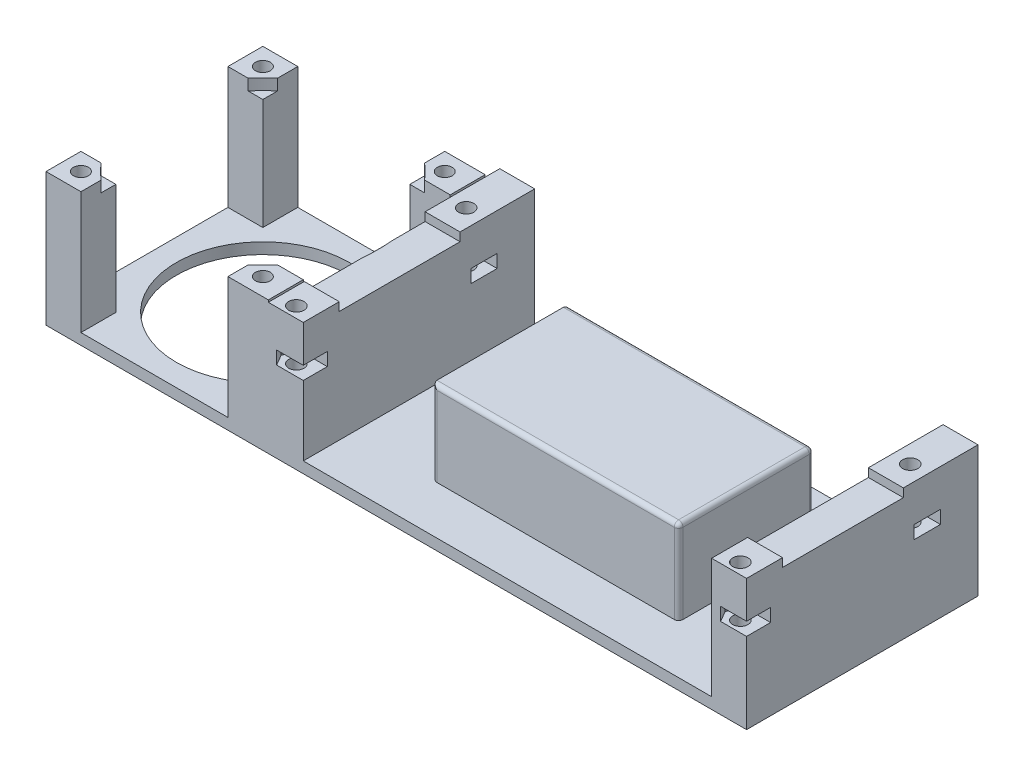
from build123d import *

# Parameters (mm, degrees)
SKETCH1_W           = 109.51405142
SKETCH1_H           = 53
SKETCH1_R           = 1.75
BOSS_EXTRUDE1_DEPTH = 30
SKETCH2_W           = 93.51405142
SKETCH2_H           = 27.46
CUT_EXTRUDE1_DEPTH  = 239.893281613
SKETCH4_W           = 53.34
SKETCH4_H           = 27.94
CUT_EXTRUDE3_DEPTH  = 239.587618287
SKETCH5_W           = 56.34
SKETCH5_H           = 30.94
SKETCH5_W_2         = 53.34
SKETCH5_H_2         = 27.94
BOSS_EXTRUDE2_DEPTH = 17.78
SKETCH6_W           = 56.34
SKETCH6_H           = 30.94
BOSS_EXTRUDE3_DEPTH = 1.5
SKETCH7_W           = 7.62
SKETCH7_H           = 17.78
CUT_EXTRUDE4_DEPTH  = 237.429314807
SKETCH9_W           = 17.94
SKETCH9_H           = 2.25
CUT_EXTRUDE5_DEPTH  = 5
SKETCH10_W          = 8
SKETCH10_H          = 11.94
CUT_EXTRUDE6_DEPTH  = 2.54
SKETCH13_W          = 10
SKETCH13_H          = 37.94
CUT_EXTRUDE8_DEPTH  = 1
FILLET2_R           = 1
SKETCH11_W          = 27.660998728
SKETCH11_H          = 1.943421484
CUT_EXTRUDE7_DEPTH  = 126.308928087
SKETCH14_W          = 50.91
SKETCH14_H          = 49.656
SKETCH14_R          = 19.812
SKETCH14_R_2        = 1.7
BOSS_EXTRUDE4_DEPTH = 2.54
SKETCH15_W          = 8
SKETCH15_H          = 8
SKETCH15_R          = 1.7
SKETCH15_W_2        = 9.25
BOSS_EXTRUDE5_DEPTH = 27.94
SKETCH16_R          = 26.289
CUT_EXTRUDE9_DEPTH  = 2.54
CUT_EXTRUDE2_DEPTH  = 1.5
CUT_EXTRUDE11_DEPTH = 1


with BuildPart() as part:
    # Sketch1 → Boss-Extrude1 (new body)
    with BuildSketch(Plane(origin=(0, 0, 0), x_dir=(1, 0, 0), z_dir=(0, 1, 0))):
        with Locations((-176.24297429, 26.5)):
            Rectangle(SKETCH1_W, SKETCH1_H)
        with Locations(Location((-227.083491572, 41.4, 0), (0, 0, 270))):
            Circle(SKETCH1_R, mode=Mode.SUBTRACT)
        with Locations(Location((-227.083491572, 2.501598642, 0), (0, 0, 270))):
            Circle(SKETCH1_R, mode=Mode.SUBTRACT)
        with Locations(Location((-125.40594858, 41.4, 0), (0, 0, 270))):
            Circle(SKETCH1_R, mode=Mode.SUBTRACT)
        with Locations(Location((-125.40594858, 2.501598642, 0), (0, 0, 270))):
            Circle(SKETCH1_R, mode=Mode.SUBTRACT)
    extrude(amount=BOSS_EXTRUDE1_DEPTH)

    # Sketch2 → Cut-Extrude1 (cut, through all)
    with BuildSketch(Plane.XY):
        with Locations((-176.24297429, 16.27)):
            Rectangle(SKETCH2_W, SKETCH2_H)
    extrude(amount=-CUT_EXTRUDE1_DEPTH, mode=Mode.SUBTRACT)

    # Sketch4 → Cut-Extrude3 (cut, through all)
    with BuildSketch(Plane(origin=(0, 2.54, 0), x_dir=(1, 0, 0), z_dir=(0, 1, 0))):
        with Locations((-176.24297429, 26.5)):
            Rectangle(SKETCH4_W, SKETCH4_H)
    extrude(amount=-CUT_EXTRUDE3_DEPTH, mode=Mode.SUBTRACT)

    # Sketch5 → Boss-Extrude2 (add)
    with BuildSketch(Plane(origin=(0, 2.54, 0), x_dir=(1, 0, 0), z_dir=(0, 1, 0))):
        with Locations((-176.24297429, 26.5)):
            Rectangle(SKETCH5_W, SKETCH5_H)
        with Locations((-176.24297429, 26.5)):
            Rectangle(SKETCH5_W_2, SKETCH5_H_2, mode=Mode.SUBTRACT)
    extrude(amount=BOSS_EXTRUDE2_DEPTH)

    # Sketch6 → Boss-Extrude3 (add)
    with BuildSketch(Plane(origin=(0, 20.32, 0), x_dir=(1, 0, 0), z_dir=(0, 1, 0))):
        with Locations((-176.24297429, 26.5)):
            Rectangle(SKETCH6_W, SKETCH6_H)
    extrude(amount=BOSS_EXTRUDE3_DEPTH)

    # Sketch7 → Cut-Extrude4 (cut, through all)
    with BuildSketch(Plane.XY.offset(-40.47)):
        with Locations((-153.38297429, 11.43)):
            Rectangle(SKETCH7_W, SKETCH7_H)
    extrude(amount=-CUT_EXTRUDE4_DEPTH, mode=Mode.SUBTRACT)

    # Sketch9 → Cut-Extrude5 (cut)
    with BuildSketch(Plane(origin=(-202.91297429, 0, 0), x_dir=(0, 0, -1), z_dir=(1, 0, 0))):
        with Locations((26.5, 1.665)):
            Rectangle(SKETCH9_W, SKETCH9_H)
    extrude(amount=-CUT_EXTRUDE5_DEPTH, mode=Mode.SUBTRACT)

    # Sketch10 → Cut-Extrude6 (cut)
    with BuildSketch(Plane.XZ):
        with Locations((-145.57297429, -26.5)):
            Rectangle(SKETCH10_W, SKETCH10_H)
    extrude(amount=-CUT_EXTRUDE6_DEPTH, mode=Mode.SUBTRACT)

    # Sketch13 → Cut-Extrude8 (cut)
    with BuildSketch(Plane.XZ):
        with Locations((-154.57297429, -26.5)):
            Rectangle(SKETCH13_W, SKETCH13_H)
    extrude(amount=-CUT_EXTRUDE8_DEPTH, mode=Mode.SUBTRACT)

    # Fillet2
    # the kernel refuses this fillet: 1 mm, written as the material it takes off along each edge
    with BuildSketch(Plane(origin=(-149.07297429, 20.82, -40.97), x_dir=(0, 1, 0), z_dir=(1, 0, 0))) as fillet2_piece_1_section:
        Polygon((0, 0), (FILLET2_R * 1.02, 0), (FILLET2_R * 1.02, -FILLET2_R * 1.02), (0, -FILLET2_R * 1.02), align=None)
    fillet2_piece_1 = extrude(amount=FILLET2_R * 1.02, mode=Mode.PRIVATE)
    fillet2_piece_1 = fillet2_piece_1 - Plane(origin=(-149.07297429, 20.82, -40.97), x_dir=(0, -0.7071067811865475, 0.7071067811865475), z_dir=(1, 0, 0)) * Sphere(FILLET2_R, mode=Mode.PRIVATE)
    add(fillet2_piece_1, mode=Mode.SUBTRACT)
    with BuildSketch(Plane(origin=(-149.07297429, 20.82, -12.03), x_dir=(0, 1, 0), z_dir=(1, 0, 0))) as fillet2_piece_2_section:
        Polygon((0, 0), (FILLET2_R * 1.02, 0), (FILLET2_R * 1.02, FILLET2_R * 1.02), (0, FILLET2_R * 1.02), align=None)
    fillet2_piece_2 = extrude(amount=FILLET2_R * 1.02, mode=Mode.PRIVATE)
    fillet2_piece_2 = fillet2_piece_2 - Plane(origin=(-149.07297429, 20.82, -12.03), x_dir=(0, -0.7071067811865475, -0.7071067811865475), z_dir=(1, 0, 0)) * Sphere(FILLET2_R, mode=Mode.PRIVATE)
    add(fillet2_piece_2, mode=Mode.SUBTRACT)
    with BuildSketch(Plane(origin=(-157.19297429, 20.32, -40.47), x_dir=(0, 0, -1), z_dir=(0, -1, 0))) as fillet2_piece_3:
        with BuildLine():
            CenterArc((FILLET2_R, -FILLET2_R), FILLET2_R, 90, 90)
            Line((0, -FILLET2_R), (0, 0))
            Line((0, 0), (FILLET2_R, 0))
        make_face()
    extrude(amount=17.78, mode=Mode.SUBTRACT)
    with BuildSketch(Plane(origin=(-148.07297429, 2.54, -20.53), x_dir=(-1, 0, 0), z_dir=(0, 0, -1)), Plane(origin=(-149.57297429, 2.54, -20.53), x_dir=(0, 1, 0), z_dir=(0, 0, -1))) as fillet2_piece_4:
        with BuildLine():
            CenterArc((FILLET2_R, FILLET2_R), FILLET2_R, 180, 90)
            Line((0, FILLET2_R), (0, 0))
            Line((0, 0), (FILLET2_R, 0))
        make_face()
    extrude(amount=11.94, mode=Mode.SUBTRACT)
    with BuildSketch(Plane(origin=(-207.91297429, 2.54, -17.53), x_dir=(-1, 0, 0), z_dir=(0, 0, -1))) as fillet2_piece_5:
        with BuildLine():
            CenterArc((FILLET2_R, -FILLET2_R), FILLET2_R, 90, 90)
            Line((0, -FILLET2_R), (0, 0))
            Line((0, 0), (FILLET2_R, 0))
        make_face()
    extrude(amount=17.94, mode=Mode.SUBTRACT)
    with BuildSketch(Plane(origin=(-204.41297429, 2.79, -35.47), x_dir=(1, 0, 0), z_dir=(0, 0, 1))) as fillet2_piece_6:
        with BuildLine():
            CenterArc((FILLET2_R, FILLET2_R), FILLET2_R, 180, 90)
            Line((0, FILLET2_R), (0, 0))
            Line((0, 0), (FILLET2_R, 0))
        make_face()
    extrude(amount=17.94, mode=Mode.SUBTRACT)
    with BuildSketch(Plane(origin=(-157.19297429, 20.32, -41.97), x_dir=(0, 0, 1), z_dir=(0, -1, 0))) as fillet2_piece_7:
        with BuildLine():
            CenterArc((FILLET2_R, FILLET2_R), FILLET2_R, 180, 90)
            Line((0, FILLET2_R), (0, 0))
            Line((0, 0), (FILLET2_R, 0))
        make_face()
    extrude(amount=17.78, mode=Mode.SUBTRACT)
    with BuildSketch(Plane(origin=(-206.91297429, 21.82, -41.97), x_dir=(0, 0, 1), z_dir=(1, 0, 0)), Plane(origin=(-149.07297429, 21.82, -11.03), x_dir=(0, 0, -1), z_dir=(-1, 0, 0))) as fillet2_piece_8:
        with BuildLine():
            CenterArc((FILLET2_R, FILLET2_R), FILLET2_R, 180, 90)
            Line((0, FILLET2_R), (0, 0))
            Line((0, 0), (FILLET2_R, 0))
        make_face()
    extrude(amount=57.84, mode=Mode.SUBTRACT)
    with BuildSketch(Plane(origin=(-204.41297429, 2.54, -41.97), x_dir=(0, 0, 1), z_dir=(0, 1, 0))) as fillet2_piece_9:
        with BuildLine():
            CenterArc((FILLET2_R, FILLET2_R), FILLET2_R, 180, 90)
            Line((0, FILLET2_R), (0, 0))
            Line((0, 0), (FILLET2_R, 0))
        make_face()
    extrude(amount=21.78, mode=Mode.SUBTRACT)
    with BuildSketch(Plane(origin=(-148.07297429, 2.54, -41.97), x_dir=(0, 0, 1), z_dir=(0, 1, 0))) as fillet2_piece_10:
        with BuildLine():
            CenterArc((FILLET2_R, -FILLET2_R), FILLET2_R, 90, 90)
            Line((0, -FILLET2_R), (0, 0))
            Line((0, 0), (FILLET2_R, 0))
        make_face()
    extrude(amount=18.28, mode=Mode.SUBTRACT)
    with BuildSketch(Plane(origin=(-148.07297429, 21.82, -40.97), x_dir=(0, -1, 0), z_dir=(0, 0, 1))) as fillet2_piece_11:
        with BuildLine():
            CenterArc((FILLET2_R, -FILLET2_R), FILLET2_R, 90, 90)
            Line((0, -FILLET2_R), (0, 0))
            Line((0, 0), (FILLET2_R, 0))
        make_face()
    extrude(amount=28.94, mode=Mode.SUBTRACT)
    with BuildSketch(Plane(origin=(-148.07297429, 2.54, -11.03), x_dir=(0, 0, -1), z_dir=(0, 1, 0))) as fillet2_piece_12:
        with BuildLine():
            CenterArc((FILLET2_R, FILLET2_R), FILLET2_R, 180, 90)
            Line((0, FILLET2_R), (0, 0))
            Line((0, 0), (FILLET2_R, 0))
        make_face()
    extrude(amount=18.28, mode=Mode.SUBTRACT)
    with BuildSketch(Plane(origin=(-204.41297429, 24.32, -11.03), x_dir=(1, 0, 0), z_dir=(0, -1, 0))) as fillet2_piece_13:
        with BuildLine():
            CenterArc((FILLET2_R, -FILLET2_R), FILLET2_R, 90, 90)
            Line((0, -FILLET2_R), (0, 0))
            Line((0, 0), (FILLET2_R, 0))
        make_face()
    extrude(amount=21.78, mode=Mode.SUBTRACT)

    # Sketch11 → Cut-Extrude7 (cut, through all)
    with BuildSketch(Plane.ZY.offset(231)):
        with Locations((-22.072453187, 29.028289258)):
            Rectangle(SKETCH11_W, SKETCH11_H)
    extrude(amount=-CUT_EXTRUDE7_DEPTH, mode=Mode.SUBTRACT)

    # Sketch14 → Boss-Extrude4 (add)
    with BuildSketch(Plane.XZ):
        with Locations((-256.455, -24.828)):
            Rectangle(SKETCH14_W, SKETCH14_H)
        with Locations(Location((-257.078, -24.828, 0), (0, 0, 270))):
            Circle(SKETCH14_R, mode=Mode.SUBTRACT)
        with Locations(Location((-277.906, -45.656, 0), (0, 0, 270))):
            Circle(SKETCH14_R_2, mode=Mode.SUBTRACT)
        with Locations(Location((-236.25, -45.656, 0), (0, 0, 270))):
            Circle(SKETCH14_R_2, mode=Mode.SUBTRACT)
        with Locations(Location((-236.25, -4, 0), (0, 0, 270))):
            Circle(SKETCH14_R_2, mode=Mode.SUBTRACT)
        with Locations(Location((-277.906, -4, 0), (0, 0, 270))):
            Circle(SKETCH14_R_2, mode=Mode.SUBTRACT)
    extrude(amount=-BOSS_EXTRUDE4_DEPTH)

    # Sketch15 → Boss-Extrude5 (add)
    # profile 1 of 4: a face of its own
    with BuildSketch(Plane(origin=(0, 2.54, 0), x_dir=(1, 0, 0), z_dir=(0, 1, 0))):
        with Locations((-277.91, 45.656)):
            Rectangle(SKETCH15_W, SKETCH15_H)
        with Locations(Location((-277.906, 45.656, 0), (0, 0, 90))):
            Circle(SKETCH15_R, mode=Mode.SUBTRACT)
    # profile 2 of 4: a face of its own
    with BuildSketch(Plane(origin=(0, 2.54, 0), x_dir=(1, 0, 0), z_dir=(0, 1, 0))):
        with Locations((-235.625, 45.656)):
            Rectangle(SKETCH15_W_2, SKETCH15_H)
        with Locations(Location((-236.25, 45.656, 0), (0, 0, 90))):
            Circle(SKETCH15_R, mode=Mode.SUBTRACT)
    # profile 3 of 4: a face of its own
    with BuildSketch(Plane(origin=(0, 2.54, 0), x_dir=(1, 0, 0), z_dir=(0, 1, 0))):
        with Locations((-235.625, 4)):
            Rectangle(SKETCH15_W_2, SKETCH15_H)
        with Locations(Location((-236.25, 4, 0), (0, 0, 90))):
            Circle(SKETCH15_R, mode=Mode.SUBTRACT)
    # profile 4 of 4: a face of its own
    with BuildSketch(Plane(origin=(0, 2.54, 0), x_dir=(1, 0, 0), z_dir=(0, 1, 0))):
        with Locations((-277.91, 4)):
            Rectangle(SKETCH15_W, SKETCH15_H)
        with Locations(Location((-277.906, 4, 0), (0, 0, 90))):
            Circle(SKETCH15_R, mode=Mode.SUBTRACT)
    extrude(amount=BOSS_EXTRUDE5_DEPTH)

    # Sketch16 → Cut-Extrude9 (cut)
    with BuildSketch(Plane(origin=(0, 30.48, 0), x_dir=(1, 0, 0), z_dir=(0, 1, 0))):
        with Locations((-257.078, 24.828)):
            Circle(SKETCH16_R)
    extrude(amount=-CUT_EXTRUDE9_DEPTH, mode=Mode.SUBTRACT)

    # Sketch3 → Cut-Extrude2 (cut, symmetric)
    with BuildSketch(Plane(origin=(0, 20, 0), x_dir=(1, 0, 0), z_dir=(0, 1, 0))):
        Polygon((-123.673897772, 5.501598642), (-121.48594858, 5.501598642), (-121.48594858, -0.498401358), (-123.673897772, -0.498401358), (-127.137999388, -0.498401358), (-128.870050195, 2.501598642), (-127.137999388, 5.501598642), align=None)
        Polygon((-121.48594858, 44.4), (-123.673897772, 44.4), (-127.137999388, 44.4), (-128.870050195, 41.4), (-127.137999388, 38.4), (-123.673897772, 38.4), (-121.48594858, 38.4), align=None)
        Polygon((-228.812050808, 5.501598642), (-230.545843893, 2.504616343), (-228.817281138, -0.495377574), (-225.347949192, -0.498401358), (-222.995024046, -0.498401358), (-222.995024046, 5.501598642), align=None)
        Polygon((-228.812050808, 44.4), (-230.545843893, 41.403017701), (-228.817281138, 38.403023784), (-225.347949192, 38.4), (-223, 38.4), (-223, 44.4), align=None)
    extrude(amount=CUT_EXTRUDE2_DEPTH, both=True, mode=Mode.SUBTRACT)

    # Sketch17 → Cut-Extrude11 (cut)
    with BuildSketch(Plane.XZ):
        with BuildLine():
            Line((-141.57297429, -20.53), (-141.57297429, -32.47))
            ThreePointArc((-141.57297429, -32.47), (-135.60297429, -26.5), (-141.57297429, -20.53))
        make_face()
    extrude(amount=-CUT_EXTRUDE11_DEPTH, mode=Mode.SUBTRACT)


solid = part.part
